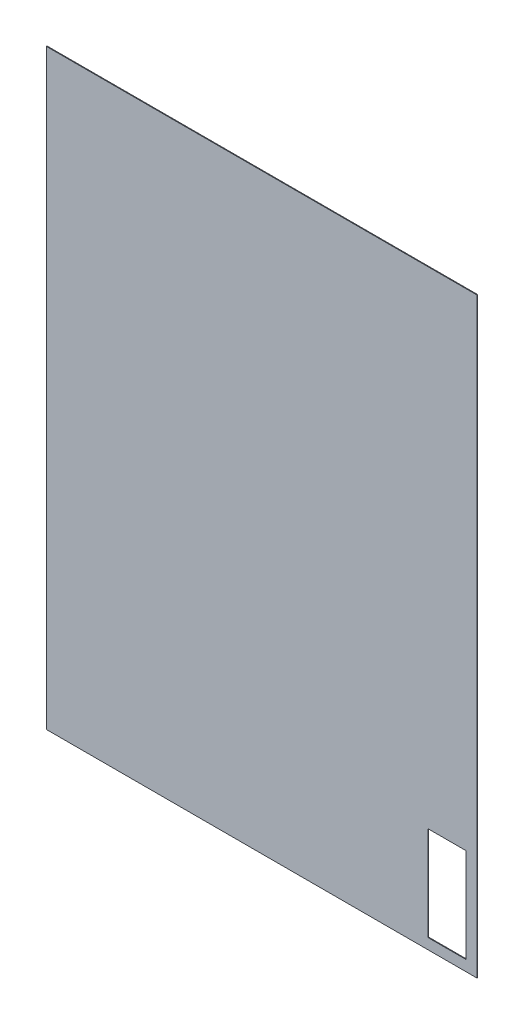
from build123d import *

# Parameters (mm, degrees)
SKETCH1_W           = 1215
SKETCH1_H           = 1670
SKETCH1_W_2         = 108.35
SKETCH1_H_2         = 266
BOSS_EXTRUDE1_DEPTH = 2


with BuildPart() as part:
    # Sketch1 → Boss-Extrude1 (new body)
    with BuildSketch(Plane.XY):
        with Locations((607.5, 835)):
            Rectangle(SKETCH1_W, SKETCH1_H)
        with Locations((1130.825, 163)):
            Rectangle(SKETCH1_W_2, SKETCH1_H_2, mode=Mode.SUBTRACT)
    extrude(amount=BOSS_EXTRUDE1_DEPTH)


solid = part.part
